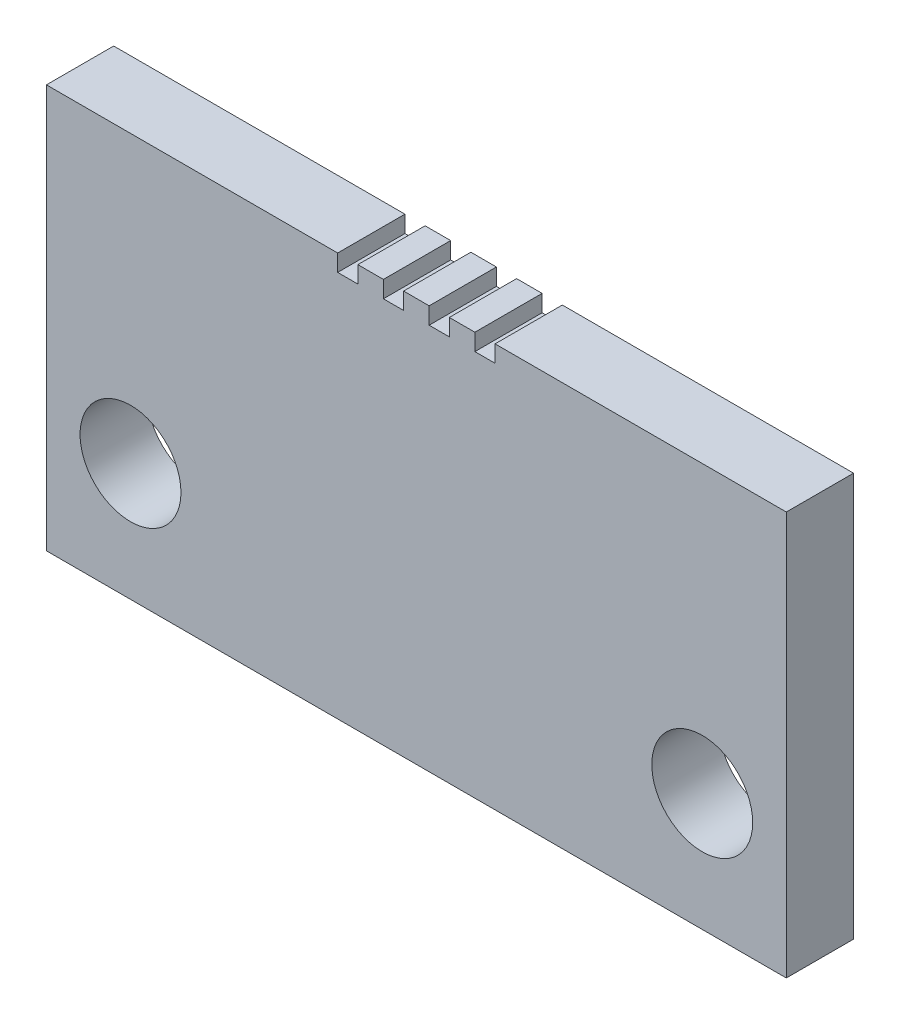
from build123d import *

# Parameters (mm, degrees)
SKETCH1_R           = 1.5
BOSS_EXTRUDE1_DEPTH = 2


with BuildPart() as part:
    # Sketch1 → Boss-Extrude1 (new body)
    with BuildSketch(Plane.XY):
        Polygon((-11, -6), (11, -6), (11, 6), (2.34, 6), (2.34, 5.5), (1.74, 5.5), (1.74, 6), (0.98, 6), (0.98, 5.5), (0.38, 5.5), (0.38, 6), (-0.38, 6), (-0.38, 5.5), (-0.98, 5.5), (-0.98, 6), (-1.74, 6), (-1.74, 5.5), (-2.34, 5.5), (-2.34, 6), (-11, 6), align=None)
        with Locations((8.5, -2.5)):
            Circle(SKETCH1_R, mode=Mode.SUBTRACT)
        with Locations((-8.5, -2.5)):
            Circle(SKETCH1_R, mode=Mode.SUBTRACT)
    extrude(amount=BOSS_EXTRUDE1_DEPTH)


solid = part.part
